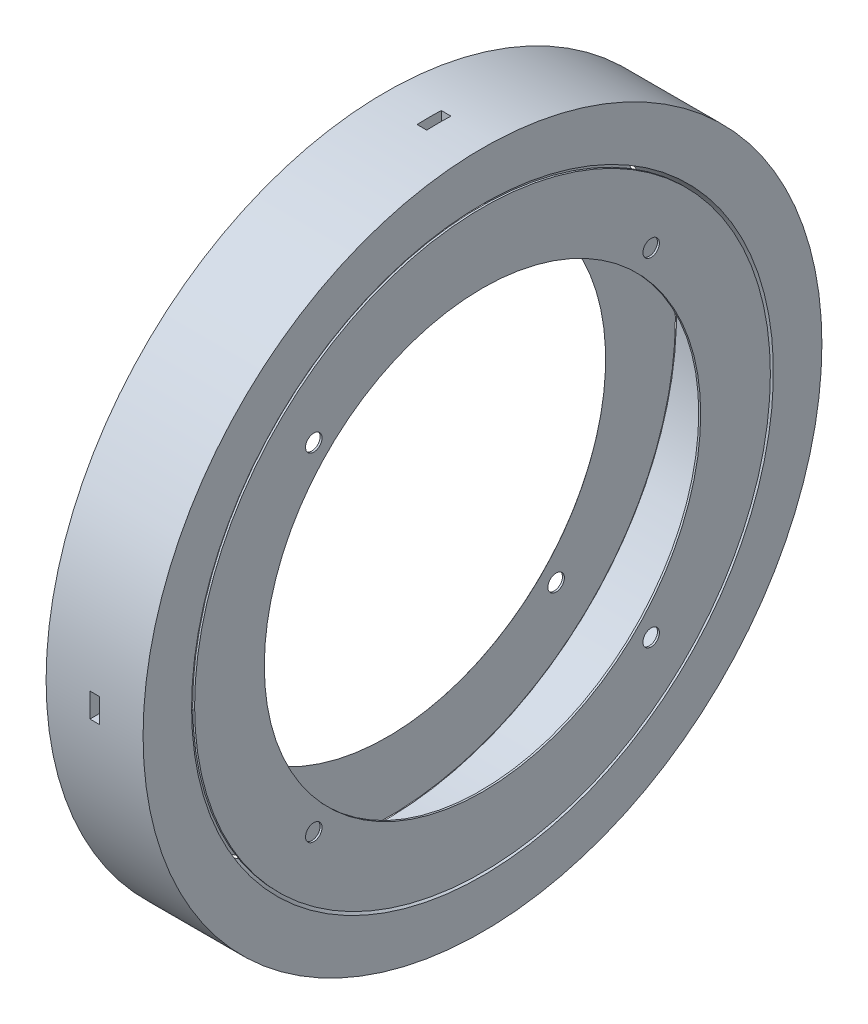
from build123d import *

# Parameters (mm, degrees)
SKETCH_1_W                       = 10
SKETCH_1_H                       = 35
HOLE_WIZARD_M52_1_D              = 60
SKETCH_4_R                       = 29.6875
EXTRUDE_1_DEPTH                  = 0.2
SKETCH_6_R                       = 29.6875
EXTRUDE_2_DEPTH                  = 0.2
SKETCH_7_R                       = 22.5
CUT_EXTRUDE_1_DEPTH              = 3.333333333
SKETCH_10_R                      = 22.5
CUT_EXTRUDE_4_DEPTH              = 3.333333333
CUT_EXTRUDE_5_REACH              = 73.609
CUT_EXTRUDE_5_END_RADIUS         = 35
SKETCH_11_W                      = 1
SKETCH_11_H                      = 2.5
CUT_EXTRUDE_6_REACH              = 73.609
CUT_EXTRUDE_6_END_RADIUS         = 35
SKETCH_12_W                      = 1
SKETCH_12_H                      = 2.5
CUT_EXTRUDE_7_REACH              = 73.609
CUT_EXTRUDE_7_END_RADIUS         = 35
SKETCH_13_W                      = 1
SKETCH_13_H                      = 2.5
CUT_EXTRUDE_8_REACH              = 73.609
CUT_EXTRUDE_8_END_RADIUS         = 35
SKETCH_14_W                      = 1
SKETCH_14_H                      = 2.5
SKETCH_15_W                      = 0.85
SKETCH_15_H                      = 0.85
HOLE_WIZARD_1_7_1_7_1_AT_2_COUNT = 2
HOLE_WIZARD_1_7_1_7_1_AT_2_PITCH = 34.789653634
HOLE_WIZARD_1_7_1_7_1_AT_3_COUNT = 2
HOLE_WIZARD_1_7_1_7_1_AT_3_PITCH = 49.2
HOLE_WIZARD_1_7_1_7_1_AT_4_COUNT = 2
HOLE_WIZARD_1_7_1_7_1_AT_4_PITCH = 34.789653634
SKETCH_17_W                      = 0.85
SKETCH_17_H                      = 0.85
HOLE_WIZARD_1_7_1_7_2_AT_2_COUNT = 2
HOLE_WIZARD_1_7_1_7_2_AT_2_PITCH = 34.789653634
HOLE_WIZARD_1_7_1_7_2_AT_3_COUNT = 2
HOLE_WIZARD_1_7_1_7_2_AT_3_PITCH = 49.2
HOLE_WIZARD_1_7_1_7_2_AT_4_COUNT = 2
HOLE_WIZARD_1_7_1_7_2_AT_4_PITCH = 34.789653634
FILLET_2_R                       = 0.6


with BuildPart() as part:
    # 草图1 → 旋转1 (revolve)
    with BuildSketch(Plane.XY, mode=Mode.PRIVATE) as revolve_1_sk:
        with Locations((5, 17.5)):
            Rectangle(SKETCH_1_W, SKETCH_1_H)
    revolve(revolve_1_sk.sketch.rotate(Axis((0, 0, 0), (1, 0, 0)), 270), axis=Axis((0, 0, 0), (1, 0, 0)))

    # M52 间隙孔1 (through all)
    with Locations(Plane.ZY):
        with Locations((0, 0)):
            Hole(HOLE_WIZARD_M52_1_D / 2)

    # 切除-拉伸5: up to this cylinder (the profile starts inside it)
    cut_extrude_5_end = Plane(origin=(5, 0, 0), z_dir=(1, 0, 0)) * Cylinder(CUT_EXTRUDE_5_END_RADIUS, 218.218, mode=Mode.PRIVATE)
    # 草图11 → 切除-拉伸5 (cut, up to the surface)
    with BuildSketch(Plane.XY.offset(26.666666667), mode=Mode.PRIVATE) as cut_extrude_5_sk1:
        with Locations((5, 0)):
            Rectangle(SKETCH_11_W, SKETCH_11_H)
    cut_extrude_5_tool1 = extrude(cut_extrude_5_sk1.sketch, amount=-CUT_EXTRUDE_5_REACH, mode=Mode.PRIVATE) & cut_extrude_5_end
    add(cut_extrude_5_tool1.solids().sort_by_distance((5, 0, 26.666667))[0], mode=Mode.SUBTRACT)

    # 切除-拉伸6: up to this cylinder (the profile starts inside it)
    cut_extrude_6_end = Plane(origin=(5, 0, 0), z_dir=(1, 0, 0)) * Cylinder(CUT_EXTRUDE_6_END_RADIUS, 218.218, mode=Mode.PRIVATE)
    # 草图12 → 切除-拉伸6 (cut, up to the surface)
    with BuildSketch(Plane(origin=(0, 0, -26.666666667), x_dir=(-1, 0, 0), z_dir=(0, 0, -1)), mode=Mode.PRIVATE) as cut_extrude_6_sk1:
        with Locations((-5, 0)):
            Rectangle(SKETCH_12_W, SKETCH_12_H)
    cut_extrude_6_tool1 = extrude(cut_extrude_6_sk1.sketch, amount=-CUT_EXTRUDE_6_REACH, mode=Mode.PRIVATE) & cut_extrude_6_end
    add(cut_extrude_6_tool1.solids().sort_by_distance((5, 0, -26.666667))[0], mode=Mode.SUBTRACT)

    # 切除-拉伸7: up to this cylinder (the profile starts inside it)
    cut_extrude_7_end = Plane(origin=(5, 0, 0), z_dir=(1, 0, 0)) * Cylinder(CUT_EXTRUDE_7_END_RADIUS, 218.218, mode=Mode.PRIVATE)
    # 草图13 → 切除-拉伸7 (cut, up to the surface)
    with BuildSketch(Plane.XZ.offset(26.666666667), mode=Mode.PRIVATE) as cut_extrude_7_sk1:
        with Locations((5, 0)):
            Rectangle(SKETCH_13_W, SKETCH_13_H)
    cut_extrude_7_tool1 = extrude(cut_extrude_7_sk1.sketch, amount=-CUT_EXTRUDE_7_REACH, mode=Mode.PRIVATE) & cut_extrude_7_end
    add(cut_extrude_7_tool1.solids().sort_by_distance((5, -26.666667, 0))[0], mode=Mode.SUBTRACT)

    # 切除-拉伸8: up to this cylinder (the profile starts inside it)
    cut_extrude_8_end = Plane(origin=(5, 0, 0), z_dir=(1, 0, 0)) * Cylinder(CUT_EXTRUDE_8_END_RADIUS, 218.218, mode=Mode.PRIVATE)
    # 草图14 → 切除-拉伸8 (cut, up to the surface)
    with BuildSketch(Plane(origin=(0, 26.666666667, 0), x_dir=(1, 0, 0), z_dir=(0, 1, 0)), mode=Mode.PRIVATE) as cut_extrude_8_sk1:
        with Locations((5, 0)):
            Rectangle(SKETCH_14_W, SKETCH_14_H)
    cut_extrude_8_tool1 = extrude(cut_extrude_8_sk1.sketch, amount=-CUT_EXTRUDE_8_REACH, mode=Mode.PRIVATE) & cut_extrude_8_end
    add(cut_extrude_8_tool1.solids().sort_by_distance((5, 26.666667, 0))[0], mode=Mode.SUBTRACT)


with BuildPart() as body_2:
    # 草图4 → 凸台-拉伸1 (new body)
    with BuildSketch(Plane(origin=(0.2, 0, 0), x_dir=(0, 0, -1), z_dir=(1, 0, 0))):
        with Locations(Location((0, 0, 0), (0, 0, 180))):
            Circle(SKETCH_4_R)
    extrude(amount=-EXTRUDE_1_DEPTH)

    # 草图7 → 切除-拉伸1 (cut)
    with BuildSketch(Plane.ZY):
        Circle(SKETCH_7_R)
    extrude(amount=-CUT_EXTRUDE_1_DEPTH, mode=Mode.SUBTRACT)

    # 草图17 → Ø1.7 (1.7) 直径孔2 (revolve, cut)
    with BuildSketch(Plane(origin=(0, 17.394826817, 17.394826817), x_dir=(0, 0, 1), z_dir=(0, 1, 0))):
        with Locations((0.425, 0.425)):
            Rectangle(SKETCH_17_W, SKETCH_17_H)
    hole_wizard_1_7_1_7_2 = revolve(axis=Axis((-6.35, 17.394826817, 17.394826817), (1, 0, 0)), mode=Mode.SUBTRACT)

    # Ø1.7 (1.7) 直径孔2 at 2: Ø1.7 (1.7) 直径孔2 ×2
    with Locations(*[(0, -i * HOLE_WIZARD_1_7_1_7_2_AT_2_PITCH, 0) for i in range(1, HOLE_WIZARD_1_7_1_7_2_AT_2_COUNT)]):
        add(hole_wizard_1_7_1_7_2, mode=Mode.SUBTRACT)

    # Ø1.7 (1.7) 直径孔2 at 3: Ø1.7 (1.7) 直径孔2 ×2
    with Locations(*[Vector(0, -0.7071067811865476, -0.7071067811865475) * (i * HOLE_WIZARD_1_7_1_7_2_AT_3_PITCH) for i in range(1, HOLE_WIZARD_1_7_1_7_2_AT_3_COUNT)]):
        add(hole_wizard_1_7_1_7_2, mode=Mode.SUBTRACT)

    # Ø1.7 (1.7) 直径孔2 at 4: Ø1.7 (1.7) 直径孔2 ×2
    with Locations(*[(0, 0, -i * HOLE_WIZARD_1_7_1_7_2_AT_4_PITCH) for i in range(1, HOLE_WIZARD_1_7_1_7_2_AT_4_COUNT)]):
        add(hole_wizard_1_7_1_7_2, mode=Mode.SUBTRACT)

    # 圆角2
    # the kernel refuses this fillet: 0.6 mm, written as the material it takes off along each edge
    with BuildSketch(Plane(origin=(0, 0, 0), x_dir=(0, 0, 1), z_dir=(0, -1, 0))) as fillet_2_piece_1:
        with BuildLine():
            CenterArc((22.947213595, -0.6), FILLET_2_R, 90, 48.189685104)
            Line((22.5, -0.2), (22.491055728, -0.192))
            ThreePointArc((22.491055728, -0.192), (22.488, -0.1), (22.488, 0))
            Line((22.488, 0), (22.5, 0.012))
            Line((22.5, 0.012), (22.947213595, 0.012))
            Line((22.947213595, 0.012), (22.947213595, 0))
        make_face()
    revolve(axis=Axis((0, 0, 0), (-1, 0, 0)), mode=Mode.SUBTRACT)


with BuildPart() as body_3:
    # 草图6 → 凸台-拉伸2 (new body)
    with BuildSketch(Plane(origin=(9.8, 0, 0), x_dir=(0, -1, 0), z_dir=(-1, 0, 0))):
        with Locations(Location((0, 0, 0), (0, 0, 270))):
            Circle(SKETCH_6_R)
    extrude(amount=-EXTRUDE_2_DEPTH)

    # 草图10 → 切除-拉伸4 (cut)
    with BuildSketch(Plane(origin=(10, 0, 0), x_dir=(0, 0, -1), z_dir=(1, 0, 0))):
        Circle(SKETCH_10_R)
    extrude(amount=-CUT_EXTRUDE_4_DEPTH, mode=Mode.SUBTRACT)

    # 草图15 → Ø1.7 (1.7) 直径孔1 (revolve, cut)
    with BuildSketch(Plane(origin=(10, 17.394826817, 17.394826817), x_dir=(0, 0, -1), z_dir=(0, 1, 0))):
        with Locations((0.425, 0.425)):
            Rectangle(SKETCH_15_W, SKETCH_15_H)
    hole_wizard_1_7_1_7_1 = revolve(axis=Axis((16.35, 17.394826817, 17.394826817), (-1, 0, 0)), mode=Mode.SUBTRACT)

    # Ø1.7 (1.7) 直径孔1 at 2: Ø1.7 (1.7) 直径孔1 ×2
    with Locations(*[(0, -i * HOLE_WIZARD_1_7_1_7_1_AT_2_PITCH, 0) for i in range(1, HOLE_WIZARD_1_7_1_7_1_AT_2_COUNT)]):
        add(hole_wizard_1_7_1_7_1, mode=Mode.SUBTRACT)

    # Ø1.7 (1.7) 直径孔1 at 3: Ø1.7 (1.7) 直径孔1 ×2
    with Locations(*[Vector(0, -0.7071067811865476, -0.7071067811865475) * (i * HOLE_WIZARD_1_7_1_7_1_AT_3_PITCH) for i in range(1, HOLE_WIZARD_1_7_1_7_1_AT_3_COUNT)]):
        add(hole_wizard_1_7_1_7_1, mode=Mode.SUBTRACT)

    # Ø1.7 (1.7) 直径孔1 at 4: Ø1.7 (1.7) 直径孔1 ×2
    with Locations(*[(0, 0, -i * HOLE_WIZARD_1_7_1_7_1_AT_4_PITCH) for i in range(1, HOLE_WIZARD_1_7_1_7_1_AT_4_COUNT)]):
        add(hole_wizard_1_7_1_7_1, mode=Mode.SUBTRACT)


solid = Compound([part.part, body_2.part, body_3.part])
